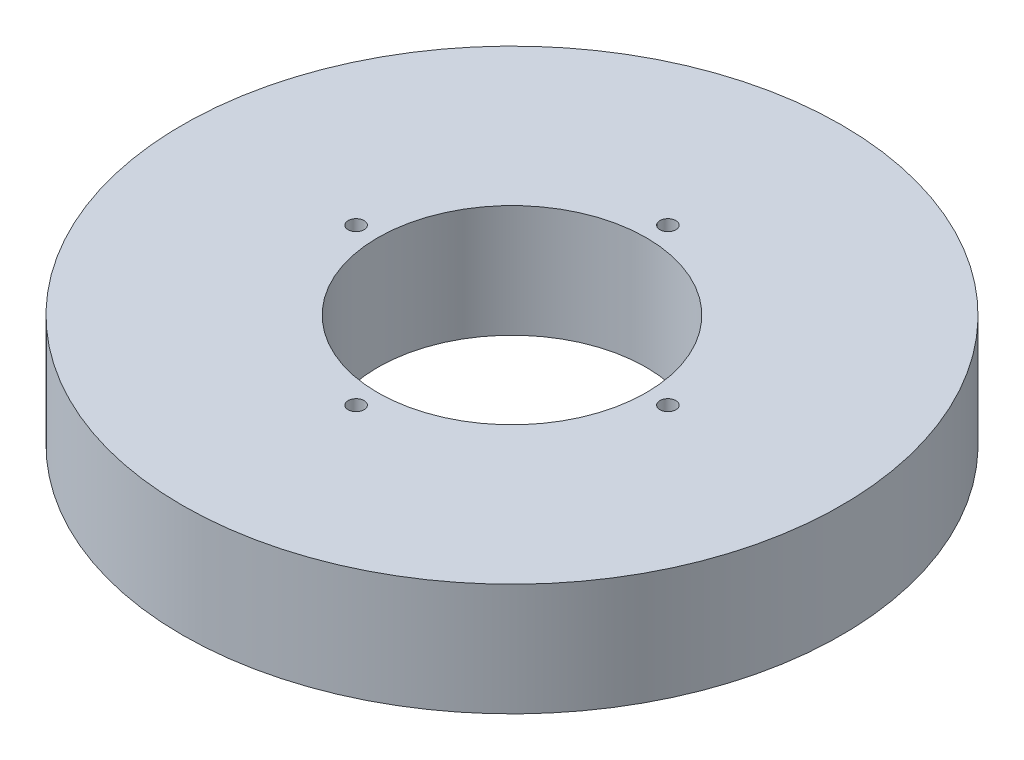
from build123d import *

# Parameters (mm, degrees)
SKETCH1_R           = 67.5
BOSS_EXTRUDE1_DEPTH = 23
SKETCH2_R           = 27.5
CUT_EXTRUDE1_DEPTH  = 99.19114013
SKETCH3_R           = 1.636952975
CUT_EXTRUDE2_DEPTH  = 22.238487332
CIRPATTERN1_COUNT   = 4


with BuildPart() as part:
    # Sketch1 → Boss-Extrude1 (new body)
    with BuildSketch(Plane(origin=(0, 0, 0), x_dir=(1, 0, 0), z_dir=(0, 1, 0))):
        Circle(SKETCH1_R)
    extrude(amount=BOSS_EXTRUDE1_DEPTH)

    # Sketch2 → Cut-Extrude1 (cut, through all)
    with BuildSketch(Plane(origin=(0, 0, 0), x_dir=(1, 0, 0), z_dir=(0, 1, 0))):
        Circle(SKETCH2_R)
    extrude(amount=CUT_EXTRUDE1_DEPTH, mode=Mode.SUBTRACT)

    # Sketch3 → Cut-Extrude2 (cut)
    with BuildSketch(Plane(origin=(0, 23, 0), x_dir=(1, 0, 0), z_dir=(0, 1, 0))):
        with Locations((-31.931188288, 0)):
            Circle(SKETCH3_R)
    cut_extrude2 = extrude(amount=-CUT_EXTRUDE2_DEPTH, mode=Mode.SUBTRACT)

    # CirPattern1: Cut-Extrude2 ×4 about axis
    cirpattern1_axis = Axis((0, 0, 0), (0, 1, 0))
    for i in range(1, CIRPATTERN1_COUNT):
        add(cut_extrude2.rotate(cirpattern1_axis, i * 360 / CIRPATTERN1_COUNT), mode=Mode.SUBTRACT)


solid = part.part
